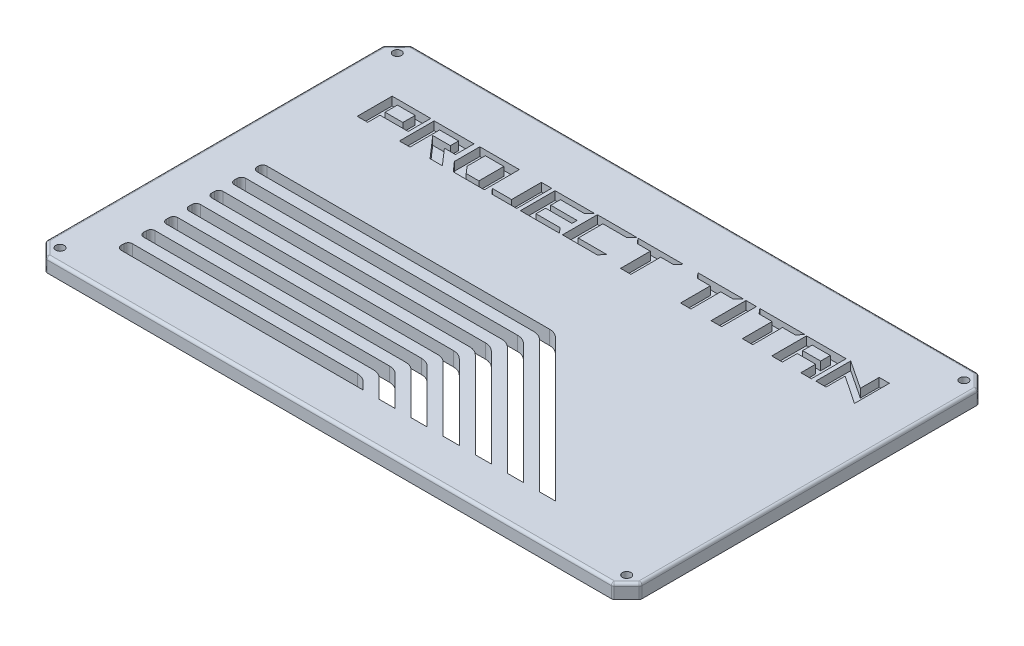
from build123d import *

# Parameters (mm, degrees)
SKETCH1_W           = 105
SKETCH1_H           = 69
BOSS_EXTRUDE1_DEPTH = 5
SKETCH2_W           = 86.836
SKETCH2_H           = 57.499
CUT_EXTRUDE1_DEPTH  = 81.210381
CUT_EXTRUDE2_DEPTH  = 1
SKETCH4_W           = 5
SKETCH4_H           = 2.165
SKETCH4_H_2         = 0.335
CUT_EXTRUDE3_DEPTH  = 1
CUT_EXTRUDE4_DEPTH  = 81.210381
SKETCH9_R           = 1
CUT_EXTRUDE7_DEPTH  = 4
SKETCH7_W           = 105
SKETCH7_H           = 30
BOSS_EXTRUDE2_DEPTH = 5
SKETCH8_W           = 11
SKETCH8_H           = 13.2
CUT_EXTRUDE6_DEPTH  = 84.315665
SKETCH10_W          = 105
SKETCH10_H          = 99
SKETCH10_W_2        = 11
SKETCH10_H_2        = 13.2
SKETCH10_H_3        = 30
BOSS_EXTRUDE3_DEPTH = 2
SKETCH11_W          = 77.336
SKETCH11_H          = 53.499
BOSS_EXTRUDE4_DEPTH = 2
CHAMFER1_SIZE       = 1
SKETCH12_W          = 65
SKETCH12_H          = 129
SKETCH12_R          = 6
BOSS_EXTRUDE5_DEPTH = 7
CUT_EXTRUDE8_DEPTH  = 135.221831
CUT_EXTRUDE9_START  = -3
SKETCH16_R          = 5.5
SKETCH16_R_2        = 3.1
CUT_EXTRUDE9_DEPTH  = 3
SKETCH18_R          = 10
CUT_EXTRUDE10_DEPTH = 3
CHAMFER2_SIZE       = 1
SKETCH19_W          = 17.7
SKETCH19_H          = 13.5
CUT_EXTRUDE11_DEPTH = 2
SKETCH20_W          = 17.7
SKETCH20_H          = 3.413443
SKETCH20_H_2        = 4.222497
CUT_EXTRUDE12_DEPTH = 1
SKETCH22_W          = 35.5
SKETCH22_H          = 10
SKETCH22_R          = 1
CUT_EXTRUDE13_DEPTH = 2
SKETCH23_R          = 1
CUT_EXTRUDE14_DEPTH = 4
CUT_EXTRUDE15_DEPTH = 1
SKETCH25_R          = 3.1
CUT_EXTRUDE16_DEPTH = 135.221831
SKETCH26_R          = 5.15
CUT_EXTRUDE17_DEPTH = 4
SKETCH27_W          = 40
SKETCH27_H          = 129
BOSS_EXTRUDE6_DEPTH = 7
LPATTERN1_COUNT     = 2
LPATTERN1_PITCH     = 40
SKETCH28_R          = 3.45
CUT_EXTRUDE18_DEPTH = 135.221831
SKETCH29_R          = 3.45
CUT_EXTRUDE19_DEPTH = 135.221831
SKETCH30_R          = 5
CUT_EXTRUDE20_DEPTH = 4.5
SKETCH31_R          = 5.5
CUT_EXTRUDE21_DEPTH = 2
CUT_EXTRUDE22_DEPTH = 2.5
LPATTERN2_COUNT     = 4
LPATTERN2_PITCH     = 32
SKETCH33_R          = 6
CUT_EXTRUDE23_DEPTH = 135.221831
SKETCH34_R          = 10
CUT_EXTRUDE24_DEPTH = 3
CHAMFER3_SIZE       = 1
CHAMFER4_SIZE       = 5
FILLET1_R           = 1
SKETCH36_R          = 1.5
CUT_EXTRUDE25_DEPTH = 135.221831
SKETCH38_W          = 2.122677
SKETCH38_H          = 1.133369
SKETCH38_W_2        = 1.231776
SKETCH38_H_2        = 4.10931
SKETCH38_W_3        = 2.093359
SKETCH38_H_3        = 1.448948
SKETCH38_W_4        = 2.046448
SKETCH38_H_4        = 0.961655
SKETCH38_H_5        = 1.340362
CUT_EXTRUDE27_DEPTH = 2
SKETCH40_R          = 6
CUT_EXTRUDE28_DEPTH = 135.221831
SKETCH41_R          = 1.5
BOSS_EXTRUDE7_DEPTH = 7
CUT_EXTRUDE29_START = -2
CUT_EXTRUDE29_DEPTH = 2
CUT_EXTRUDE30_DEPTH = 135.132397
FILLET2_R           = 1.5
SKETCH44_W          = 6.280076
SKETCH44_H          = 4.346843
SKETCH44_W_2        = 3.695328
SKETCH44_H_2        = 12.32793
SKETCH44_W_3        = 6.368032
SKETCH44_H_3        = 3.400107
CUT_EXTRUDE31_DEPTH = 3
FILLET3_R           = 5
FILLET4_R           = 1


with BuildPart() as part:
    # Sketch1 → Boss-Extrude1 (new body)
    with BuildSketch(Plane(origin=(0, 0, 0), x_dir=(1, 0, 0), z_dir=(0, 1, 0))):
        Rectangle(SKETCH1_W, SKETCH1_H)
    extrude(amount=BOSS_EXTRUDE1_DEPTH)

    # Sketch2 → Cut-Extrude1 (cut, through all)
    with BuildSketch(Plane(origin=(17.072113, 0, 5.103361), x_dir=(-1, 0, 0), z_dir=(0, -1, 0))):
        with Locations((16.310113, 4.341361)):
            Rectangle(SKETCH2_W, SKETCH2_H)
    extrude(amount=-CUT_EXTRUDE1_DEPTH, mode=Mode.SUBTRACT)

    # Sketch3 → Cut-Extrude2 (cut)
    with BuildSketch(Plane(origin=(17.072113, 0, 5.103361), x_dir=(-1, 0, 0), z_dir=(0, -1, 0))):
        Polygon((59.822113, 30.765861), (54.524774, 30.765861), (54.524774, -16.234139), (59.822113, -16.234139), (65.822113, -16.234139), (65.822113, 30.765861), align=None)
    extrude(amount=-CUT_EXTRUDE2_DEPTH, mode=Mode.SUBTRACT)

    # Sketch4 → Cut-Extrude3 (cut)
    with BuildSketch(Plane(origin=(17.072113, 0, 5.103361), x_dir=(-1, 0, 0), z_dir=(0, -1, 0))):
        Polygon((-1.187888, 35.255861), (3.812112, 35.255861), (3.812112, 33.090861), (4.312112, 33.090861), (4.312112, 35.755861), (-1.687888, 35.755861), (-1.687888, 33.090861), (-1.187888, 33.090861), align=None)
        with Locations((1.312112, 34.173361)):
            Rectangle(SKETCH4_W, SKETCH4_H)
        Polygon((4.312112, 33.090861), (3.812112, 33.090861), (3.812112, 32.755861), (-1.187888, 32.755861), (-1.187888, 33.090861), (-1.687888, 33.090861), (-1.687888, 32.255861), (4.312112, 32.255861), align=None)
        with Locations((1.312112, 32.923361)):
            Rectangle(SKETCH4_W, SKETCH4_H_2)
    extrude(amount=-CUT_EXTRUDE3_DEPTH, mode=Mode.SUBTRACT)

    # Sketch5 → Cut-Extrude4 (cut, through all)
    with BuildSketch(Plane(origin=(17.072113, 0, 5.103361), x_dir=(-1, 0, 0), z_dir=(0, -1, 0))):
        with BuildLine():
            Line((-31.677887, -0.896639), (-31.677887, 11.103361))
            ThreePointArc((-31.677887, 11.103361), (-31.2204, 12.207833), (-30.115928, 12.66532))
            Line((-30.115928, 12.66532), (-28.350144, 12.66532))
            ThreePointArc((-28.350144, 12.66532), (-27.521233, 13.008666), (-27.177887, 13.837577))
            Line((-27.177887, 13.837577), (-18.865935, 13.837577))
            Line((-18.865935, 13.837577), (-18.865935, -4.565971))
            Line((-18.865935, -4.565971), (-27.177887, -4.565971))
            ThreePointArc((-27.177887, -4.565971), (-27.608416, -3.526581), (-28.647806, -3.096052))
            Line((-28.647806, -3.096052), (-29.478474, -3.096052))
            ThreePointArc((-29.478474, -3.096052), (-31.033694, -2.451859), (-31.677887, -0.896639))
        make_face()
    extrude(amount=-CUT_EXTRUDE4_DEPTH, mode=Mode.SUBTRACT)

    # Sketch9 → Cut-Extrude7 (cut)
    with BuildSketch(Plane(origin=(17.072113, 0, 5.103361), x_dir=(-1, 0, 0), z_dir=(0, -1, 0))):
        with Locations(Location((-28.677887, 33.103361, 0), (0, 0, 90))):
            Circle(SKETCH9_R)
        with Locations(Location((62.822113, 33.103361, 0), (0, 0, 90))):
            Circle(SKETCH9_R)
        with Locations(Location((-28.677887, -22.896639, 0), (0, 0, 90))):
            Circle(SKETCH9_R)
        with Locations(Location((62.822113, -22.896639, 0), (0, 0, 90))):
            Circle(SKETCH9_R)
    extrude(amount=-CUT_EXTRUDE7_DEPTH, mode=Mode.SUBTRACT)

    # Sketch7 → Boss-Extrude2 (add)
    with BuildSketch(Plane(origin=(0, 5, 0), x_dir=(1, 0, 0), z_dir=(0, 1, 0))):
        with Locations((0, 49.5)):
            Rectangle(SKETCH7_W, SKETCH7_H)
        with Locations((0, -49.5)):
            Rectangle(SKETCH7_W, SKETCH7_H)
    extrude(amount=-BOSS_EXTRUDE2_DEPTH)

    # Sketch8 → Cut-Extrude6 (cut, through all)
    with BuildSketch(Plane(origin=(0, 5, 0), x_dir=(1, 0, 0), z_dir=(0, 1, 0))):
        with Locations((32.18, 46.886315)):
            Rectangle(SKETCH8_W, SKETCH8_H)
    extrude(amount=-CUT_EXTRUDE6_DEPTH, mode=Mode.SUBTRACT)

    # Sketch10 → Boss-Extrude3 (add)
    # profile 1 of 2: a face of its own
    with BuildSketch(Plane(origin=(0, 5, 0), x_dir=(1, 0, 0), z_dir=(0, 1, 0))):
        with Locations((0, 15)):
            Rectangle(SKETCH10_W, SKETCH10_H)
        Polygon((-42.656, 27.9875), (44.18, 27.9875), (44.18, 8.734216), (44.18, -9.669332), (44.18, -29.5115), (-42.656, -29.5115), align=None, mode=Mode.SUBTRACT)
        with Locations((32.18, 46.886315)):
            Rectangle(SKETCH10_W_2, SKETCH10_H_2, mode=Mode.SUBTRACT)
    # profile 2 of 2: a face of its own
    with BuildSketch(Plane(origin=(0, 5, 0), x_dir=(1, 0, 0), z_dir=(0, 1, 0))):
        with Locations((0, -49.5)):
            Rectangle(SKETCH10_W, SKETCH10_H_3)
    extrude(amount=BOSS_EXTRUDE3_DEPTH)

    # Sketch11 → Boss-Extrude4 (add)
    with BuildSketch(Plane(origin=(0, 7, 0), x_dir=(1, 0, 0), z_dir=(0, 1, 0))):
        Polygon((-40.656, 27.9875), (-42.656, 27.9875), (-42.656, 25.9875), (-42.656, -27.5115), (-42.656, -29.5115), (-40.656, -29.5115), (36.68, -29.5115), (44.18, -29.5115), (44.18, 27.9875), (36.68, 27.9875), align=None)
        with Locations((-1.988, -0.762)):
            Rectangle(SKETCH11_W, SKETCH11_H, mode=Mode.SUBTRACT)
    extrude(amount=-BOSS_EXTRUDE4_DEPTH)

    # Chamfer1
    chamfer1_edges = [part.edges().sort_by_distance(p)[0] for p in [
        (-40.656, 7, 0.762),
        (-1.988, 7, 27.5115),
        (36.68, 7, 0.762),
        (-1.988, 7, -25.9875),
    ]]
    chamfer(chamfer1_edges, length=CHAMFER1_SIZE)

    # Sketch12 → Boss-Extrude5 (add)
    with BuildSketch(Plane(origin=(0, 7, 0), x_dir=(1, 0, 0), z_dir=(0, 1, 0))):
        with Locations((-85, 0)):
            Rectangle(SKETCH12_W, SKETCH12_H)
        with Locations(Location((-85, -45.5, 0), (0, 0, 270))):
            Circle(SKETCH12_R, mode=Mode.SUBTRACT)
        with Locations(Location((-102.5, -28, 0), (0, 0, 270))):
            Circle(SKETCH12_R, mode=Mode.SUBTRACT)
        with Locations(Location((-67.5, -28, 0), (0, 0, 270))):
            Circle(SKETCH12_R, mode=Mode.SUBTRACT)
        with Locations(Location((-85, -10.5, 0), (0, 0, 270))):
            Circle(SKETCH12_R, mode=Mode.SUBTRACT)
    extrude(amount=-BOSS_EXTRUDE5_DEPTH)

    # Sketch15 → Cut-Extrude8 (cut, through all)
    with BuildSketch(Plane(origin=(0, 7, 0), x_dir=(1, 0, 0), z_dir=(0, 1, 0))):
        with BuildLine():
            ThreePointArc((-28.941, -46.50575), (-32.041, -43.40575), (-35.141, -46.50575))
            Line((-35.141, -46.50575), (-28.941, -46.50575))
        make_face()
        with BuildLine():
            Line((-28.941, -46.50575), (-35.141, -46.50575))
            ThreePointArc((-35.141, -46.50575), (-32.041, -49.60575), (-28.941, -46.50575))
        make_face()
        with BuildLine():
            ThreePointArc((-8.941, -46.50575), (-12.041, -43.40575), (-15.141, -46.50575))
            Line((-15.141, -46.50575), (-8.941, -46.50575))
        make_face()
        with BuildLine():
            Line((-8.941, -46.50575), (-15.141, -46.50575))
            ThreePointArc((-15.141, -46.50575), (-12.041, -49.60575), (-8.941, -46.50575))
        make_face()
        with BuildLine():
            ThreePointArc((4.859, -46.50575), (7.959, -49.60575), (11.059, -46.50575))
            Line((11.059, -46.50575), (4.859, -46.50575))
        make_face()
        with BuildLine():
            Line((4.859, -46.50575), (11.059, -46.50575))
            ThreePointArc((11.059, -46.50575), (7.959, -43.40575), (4.859, -46.50575))
        make_face()
        with BuildLine():
            ThreePointArc((24.859, -46.50575), (27.959, -49.60575), (31.059, -46.50575))
            Line((31.059, -46.50575), (24.859, -46.50575))
        make_face()
        with BuildLine():
            Line((24.859, -46.50575), (31.059, -46.50575))
            ThreePointArc((31.059, -46.50575), (27.959, -43.40575), (24.859, -46.50575))
        make_face()
    extrude(amount=-CUT_EXTRUDE8_DEPTH, mode=Mode.SUBTRACT)

    # Sketch16 → Cut-Extrude9 (cut)
    # profile 1 of 4: a face of its own
    with BuildSketch(Plane.XZ.offset(CUT_EXTRUDE9_START)):
        with Locations(Location((-32.041, 46.50575, 0), (0, 0, 270))):
            Circle(SKETCH16_R)
        with Locations(Location((-32.041, 46.50575, 0), (0, 0, 90))):
            Circle(SKETCH16_R_2, mode=Mode.SUBTRACT)
    # profile 2 of 4: a face of its own
    with BuildSketch(Plane.XZ.offset(CUT_EXTRUDE9_START)):
        with Locations(Location((-12.041, 46.50575, 0), (0, 0, 270))):
            Circle(SKETCH16_R)
        with Locations(Location((-12.041, 46.50575, 0), (0, 0, 90))):
            Circle(SKETCH16_R_2, mode=Mode.SUBTRACT)
    # profile 3 of 4: a face of its own
    with BuildSketch(Plane.XZ.offset(CUT_EXTRUDE9_START)):
        with Locations(Location((7.959, 46.50575, 0), (0, 0, 270))):
            Circle(SKETCH16_R)
        with Locations(Location((7.959, 46.50575, 0), (0, 0, 90))):
            Circle(SKETCH16_R_2, mode=Mode.SUBTRACT)
    # profile 4 of 4: a face of its own
    with BuildSketch(Plane.XZ.offset(CUT_EXTRUDE9_START)):
        with Locations(Location((27.959, 46.50575, 0), (0, 0, 270))):
            Circle(SKETCH16_R)
        with Locations(Location((27.959, 46.50575, 0), (0, 0, 90))):
            Circle(SKETCH16_R_2, mode=Mode.SUBTRACT)
    extrude(amount=CUT_EXTRUDE9_DEPTH, mode=Mode.SUBTRACT)

    # Sketch18 → Cut-Extrude10 (cut)
    with BuildSketch(Plane.XZ):
        with Locations(Location((-85, 45.5, 0), (0, 0, 270))):
            Circle(SKETCH18_R)
        with Locations(Location((-102.5, 28, 0), (0, 0, 270))):
            Circle(SKETCH18_R)
        with Locations(Location((-85, 10.5, 0), (0, 0, 270))):
            Circle(SKETCH18_R)
        with Locations(Location((-67.5, 28, 0), (0, 0, 270))):
            Circle(SKETCH18_R)
    extrude(amount=-CUT_EXTRUDE10_DEPTH, mode=Mode.SUBTRACT)

    # Chamfer2
    chamfer2_edges = [part.edges().sort_by_distance(p)[0] for p in [
        (-85, 0, 20.5),
        (-102.5, 0, 38),
        (-67.5, 0, 38),
        (-85, 0, 55.5),
    ]]
    chamfer(chamfer2_edges, length=CHAMFER2_SIZE)

    # Sketch19 → Cut-Extrude11 (cut)
    with BuildSketch(Plane.XZ):
        with Locations((9.346, -57.75)):
            Rectangle(SKETCH19_W, SKETCH19_H)
    extrude(amount=-CUT_EXTRUDE11_DEPTH, mode=Mode.SUBTRACT)

    # Sketch20 → Cut-Extrude12 (cut)
    with BuildSketch(Plane.XZ.offset(-2)):
        with Locations((9.346, -62.793278)):
            Rectangle(SKETCH20_W, SKETCH20_H)
        with Locations((9.346, -53.111249)):
            Rectangle(SKETCH20_W, SKETCH20_H_2)
    extrude(amount=-CUT_EXTRUDE12_DEPTH, mode=Mode.SUBTRACT)

    # Sketch22 → Cut-Extrude13 (cut)
    with BuildSketch(Plane.XZ):
        with Locations((-42.589089, -59.5)):
            Rectangle(SKETCH22_W, SKETCH22_H)
        with Locations(Location((-57.839089, -59.5, 0), (0, 0, 270))):
            Circle(SKETCH22_R, mode=Mode.SUBTRACT)
    extrude(amount=-CUT_EXTRUDE13_DEPTH, mode=Mode.SUBTRACT)

    # Sketch23 → Cut-Extrude14 (cut)
    with BuildSketch(Plane.XZ):
        with Locations(Location((-57.839089, -59.5, 0), (0, 0, 270))):
            Circle(SKETCH23_R)
    extrude(amount=-CUT_EXTRUDE14_DEPTH, mode=Mode.SUBTRACT)

    # Sketch24 → Cut-Extrude15 (cut)
    with BuildSketch(Plane.XZ.offset(-2)):
        with BuildLine():
            Line((-35.839089, -62.003634), (-25.839089, -62.003634))
            ThreePointArc((-25.839089, -62.003634), (-24.842723, -63), (-25.839089, -63.996366))
            Line((-25.839089, -63.996366), (-35.839089, -63.996366))
            ThreePointArc((-35.839089, -63.996366), (-36.835455, -63), (-35.839089, -62.003634))
        make_face()
    extrude(amount=-CUT_EXTRUDE15_DEPTH, mode=Mode.SUBTRACT)

    # Sketch25 → Cut-Extrude16 (cut, through all)
    with BuildSketch(Plane(origin=(0, 7, 0), x_dir=(1, 0, 0), z_dir=(0, 1, 0))):
        with Locations(Location((-102.5, 44.5, 0), (0, 0, 270))):
            Circle(SKETCH25_R)
        with Locations(Location((-82.5, 44.5, 0), (0, 0, 270))):
            Circle(SKETCH25_R)
    cut_extrude16 = extrude(amount=-CUT_EXTRUDE16_DEPTH, mode=Mode.SUBTRACT)

    # Sketch26 → Cut-Extrude17 (cut)
    with BuildSketch(Plane.XZ):
        with Locations(Location((-102.5, -44.5, 0), (0, 0, 270))):
            Circle(SKETCH26_R)
        with Locations(Location((-82.5, -44.5, 0), (0, 0, 270))):
            Circle(SKETCH26_R)
    cut_extrude17 = extrude(amount=-CUT_EXTRUDE17_DEPTH, mode=Mode.SUBTRACT)

    # Sketch27 → Boss-Extrude6 (add)
    with BuildSketch(Plane(origin=(0, 7, 0), x_dir=(1, 0, 0), z_dir=(0, 1, 0))):
        with Locations((72.5, 0)):
            Rectangle(SKETCH27_W, SKETCH27_H)
    extrude(amount=-BOSS_EXTRUDE6_DEPTH)

    # LPattern1: Cut-Extrude16, Cut-Extrude17 ×2
    with Locations(*[(i * LPATTERN1_PITCH, 0, 0) for i in range(1, LPATTERN1_COUNT)]):
        add(cut_extrude16, mode=Mode.SUBTRACT)
        add(cut_extrude17, mode=Mode.SUBTRACT)

    # Sketch28 → Cut-Extrude18 (cut, through all)
    with BuildSketch(Plane(origin=(0, 7, 0), x_dir=(1, 0, 0), z_dir=(0, 1, 0))):
        with Locations(Location((62.5, 48.27975, 0), (0, 0, 270))):
            Circle(SKETCH28_R)
        with Locations(Location((62.5, 16.27975, 0), (0, 0, 270))):
            Circle(SKETCH28_R)
        with Locations(Location((62.5, -15.72025, 0), (0, 0, 270))):
            Circle(SKETCH28_R)
        with Locations(Location((62.5, -47.72025, 0), (0, 0, 270))):
            Circle(SKETCH28_R)
    extrude(amount=-CUT_EXTRUDE18_DEPTH, mode=Mode.SUBTRACT)

    # Sketch29 → Cut-Extrude19 (cut, through all)
    with BuildSketch(Plane(origin=(0, 7, 0), x_dir=(1, 0, 0), z_dir=(0, 1, 0))):
        with Locations(Location((83.375, 48.27975, 0), (0, 0, 270))):
            Circle(SKETCH29_R)
        with Locations(Location((83.375, 16.27975, 0), (0, 0, 270))):
            Circle(SKETCH29_R)
        with Locations(Location((83.375, -15.72025, 0), (0, 0, 270))):
            Circle(SKETCH29_R)
        with Locations(Location((83.375, -47.72025, 0), (0, 0, 270))):
            Circle(SKETCH29_R)
    extrude(amount=-CUT_EXTRUDE19_DEPTH, mode=Mode.SUBTRACT)

    # Sketch30 → Cut-Extrude20 (cut)
    with BuildSketch(Plane.XZ):
        with Locations(Location((83.375, -48.27975, 0), (0, 0, 270))):
            Circle(SKETCH30_R)
        with Locations(Location((83.375, -16.27975, 0), (0, 0, 270))):
            Circle(SKETCH30_R)
        with Locations(Location((83.375, 15.72025, 0), (0, 0, 270))):
            Circle(SKETCH30_R)
        with Locations(Location((83.375, 47.72025, 0), (0, 0, 270))):
            Circle(SKETCH30_R)
    extrude(amount=-CUT_EXTRUDE20_DEPTH, mode=Mode.SUBTRACT)

    # Sketch31 → Cut-Extrude21 (cut)
    with BuildSketch(Plane.XZ):
        with Locations(Location((62.5, 47.72025, 0), (0, 0, 270))):
            Circle(SKETCH31_R)
        with Locations(Location((62.5, 15.72025, 0), (0, 0, 270))):
            Circle(SKETCH31_R)
        with Locations(Location((62.5, -16.27975, 0), (0, 0, 270))):
            Circle(SKETCH31_R)
        with Locations(Location((62.5, -48.27975, 0), (0, 0, 270))):
            Circle(SKETCH31_R)
    extrude(amount=-CUT_EXTRUDE21_DEPTH, mode=Mode.SUBTRACT)

    # Sketch32 → Cut-Extrude22 (cut)
    with BuildSketch(Plane.XZ):
        with BuildLine():
            Line((69.950503, 49.22025), (70.968176, 49.22025))
            ThreePointArc((70.968176, 49.22025), (71.1, 47.72025), (70.968176, 46.22025))
            Line((70.968176, 46.22025), (69.950503, 46.22025))
            ThreePointArc((69.950503, 46.22025), (70.1, 47.72025), (69.950503, 49.22025))
        make_face()
        with BuildLine():
            Line((61, 56.188426), (61, 55.170753))
            ThreePointArc((61, 55.170753), (62.5, 55.32025), (64, 55.170753))
            Line((64, 55.170753), (64, 56.188426))
            ThreePointArc((64, 56.188426), (62.5, 56.32025), (61, 56.188426))
        make_face()
        with BuildLine():
            Line((54.031824, 49.22025), (55.049497, 49.22025))
            ThreePointArc((55.049497, 49.22025), (54.9, 47.72025), (55.049497, 46.22025))
            Line((55.049497, 46.22025), (54.031824, 46.22025))
            ThreePointArc((54.031824, 46.22025), (53.9, 47.72025), (54.031824, 49.22025))
        make_face()
        with BuildLine():
            Line((64, 40.269747), (64, 39.252074))
            ThreePointArc((64, 39.252074), (62.5, 39.12025), (61, 39.252074))
            Line((61, 39.252074), (61, 40.269747))
            ThreePointArc((61, 40.269747), (62.5, 40.12025), (64, 40.269747))
        make_face()
    cut_extrude22 = extrude(amount=-CUT_EXTRUDE22_DEPTH, mode=Mode.SUBTRACT)

    # LPattern2: Cut-Extrude22 ×4
    with Locations(*[(0, 0, -i * LPATTERN2_PITCH) for i in range(1, LPATTERN2_COUNT)]):
        add(cut_extrude22, mode=Mode.SUBTRACT)

    # Sketch33 → Cut-Extrude23 (cut, through all)
    with BuildSketch(Plane(origin=(0, 7, 0), x_dir=(1, 0, 0), z_dir=(0, 1, 0))):
        with Locations(Location((-52.041, -46.50575, 0), (0, 0, 270))):
            Circle(SKETCH33_R)
    extrude(amount=-CUT_EXTRUDE23_DEPTH, mode=Mode.SUBTRACT)

    # Sketch34 → Cut-Extrude24 (cut)
    with BuildSketch(Plane.XZ):
        with Locations(Location((-52.041, 46.50575, 0), (0, 0, 270))):
            Circle(SKETCH34_R)
    extrude(amount=-CUT_EXTRUDE24_DEPTH, mode=Mode.SUBTRACT)

    # Chamfer3
    chamfer3_edges = [part.edges().sort_by_distance(p)[0] for p in [
        (-52.041, 0, 56.50575),
    ]]
    chamfer(chamfer3_edges, length=CHAMFER3_SIZE)

    # Chamfer4
    chamfer4_edges = [part.edges().sort_by_distance(p)[0] for p in [
        (-117.5, 3.5, -64.5),
        (-117.5, 3.5, 64.5),
        (92.5, 3.5, -64.5),
        (92.5, 3.5, 64.5),
    ]]
    chamfer(chamfer4_edges, length=CHAMFER4_SIZE)

    # Fillet1
    fillet1_edges = [part.edges().sort_by_distance(p)[0] for p in [
        (92.5, 7, 0),
        (92.5, 3.5, 59.5),
        (92.5, 3.5, -59.5),
        (-12.5, 7, -64.5),
        (-117.5, 7, 0),
        (-12.5, 7, 64.5),
        (-115, 7, -62),
        (-115, 7, 62),
        (90, 7, 62),
        (90, 7, -62),
        (-112.5, 3.5, -64.5),
        (87.5, 3.5, -64.5),
        (-112.5, 3.5, 64.5),
        (87.5, 3.5, 64.5),
        (-117.5, 3.5, -59.5),
        (-117.5, 3.5, 59.5),
    ]]
    fillet(fillet1_edges, radius=FILLET1_R)

    # Sketch36 → Cut-Extrude25 (cut, through all)
    with BuildSketch(Plane.XZ):
        with Locations(Location((87.525126, 59.525126, 0), (0, 0, 270))):
            Circle(SKETCH36_R)
        with Locations(Location((87.525126, -59.525126, 0), (0, 0, 270))):
            Circle(SKETCH36_R)
        with Locations(Location((-112.525126, -59.525126, 0), (0, 0, 270))):
            Circle(SKETCH36_R)
        with Locations(Location((-112.526828, 59.526828, 0), (0, 0, 270))):
            Circle(SKETCH36_R)
    extrude(amount=-CUT_EXTRUDE25_DEPTH, mode=Mode.SUBTRACT)

    # Sketch38 → Cut-Extrude27 (cut)
    # profile 1 of 26: a face of its own
    with BuildSketch(Plane.XZ):
        Polygon((-112.385598, -24.375998), (-109.048803, -26.612612), (-109.048803, -24.375998), (-107.831763, -24.375998), (-107.831763, -28.485308), (-111.185901, -26.26626), (-111.185901, -28.485308), (-112.385598, -28.485308), align=None)
    # profile 2 of 26: a face of its own
    with BuildSketch(Plane.XZ):
        Polygon((-107.333036, -28.442847), (-107.333036, -24.348284), (-106.101649, -24.348284), (-106.101649, -26.095682), (-103.932061, -26.095682), (-103.932061, -24.348284), (-102.677219, -24.348284), (-102.677219, -28.442847), align=None)
        with Locations((-105.010991, -27.272196)):
            Rectangle(SKETCH38_W, SKETCH38_H, mode=Mode.SUBTRACT)
    # profile 3 of 26: a face of its own
    with BuildSketch(Plane.XZ):
        Polygon((-101.928931, -27.880614), (-100.413224, -27.880614), (-100.413224, -24.375998), (-99.190124, -24.375998), (-99.190124, -27.880614), (-97.65686, -27.880614), (-97.136019, -28.485308), (-102.449957, -28.485308), align=None)
    # profile 4 of 26: a face of its own
    with BuildSketch(Plane.XZ):
        with Locations((-96.128202, -26.430653)):
            Rectangle(SKETCH38_W_2, SKETCH38_H_2)
    # profile 5 of 26: a face of its own
    with BuildSketch(Plane.XZ):
        Polygon((-94.653653, -27.880614), (-93.137946, -27.880614), (-93.137946, -24.375998), (-91.914846, -24.375998), (-91.914846, -27.880614), (-90.381582, -27.880614), (-89.860741, -28.485308), (-95.174678, -28.485308), align=None)
    # profile 6 of 26: a face of its own
    with BuildSketch(Plane.XZ):
        Polygon((-87.595547, -27.880614), (-86.07984, -27.880614), (-86.07984, -24.375998), (-84.85674, -24.375998), (-84.85674, -27.880614), (-83.323476, -27.880614), (-82.802635, -28.485308), (-88.116572, -28.485308), align=None)
    # profile 7 of 26: a face of its own
    with BuildSketch(Plane.XZ):
        Polygon((-82.632968, -24.980647), (-82.10675, -24.375998), (-78.024839, -24.375998), (-78.024839, -28.485308), (-82.627222, -28.485308), (-82.10675, -27.880614), (-79.276313, -27.880614), (-79.276313, -24.980647), align=None)
    # profile 8 of 26: a face of its own
    with BuildSketch(Plane.XZ):
        Polygon((-77.153032, -24.968132), (-77.680695, -24.364165), (-73.084165, -24.364165), (-73.084165, -28.442847), (-77.692294, -28.442847), (-77.170621, -27.838881), (-74.315378, -27.838881), (-74.315378, -26.705512), (-77.416864, -26.705512), (-77.416864, -26.101501), (-74.315378, -26.101501), (-74.315378, -24.968132), align=None)
    # profile 9 of 26: a face of its own
    with BuildSketch(Plane.XZ):
        Polygon((-69.702276, -24.375998), (-69.17506, -24.980647), (-71.430371, -24.980647), (-71.430371, -28.485308), (-72.643033, -28.485308), (-72.643033, -24.375998), align=None)
    # profile 10 of 26: a face of its own
    with BuildSketch(Plane.XZ):
        Polygon((-68.837425, -24.370908), (-68.837425, -28.490398), (-64.185183, -28.490398), (-64.185183, -25.496689), (-65.18709, -24.370908), align=None)
        Polygon((-67.605649, -27.89996), (-67.605649, -24.961346), (-66.109619, -24.961346), (-65.416959, -25.76436), (-65.416959, -27.89996), align=None, mode=Mode.SUBTRACT)
    # profile 11 of 26: a face of its own
    with BuildSketch(Plane.XZ):
        Polygon((-63.923182, -24.346978), (-62.474836, -24.346978), (-60.264202, -26.86839), (-62.33997, -26.86839), (-62.33997, -27.838881), (-60.108108, -27.838881), (-60.108108, -24.346978), (-58.864993, -24.346978), (-58.864993, -28.442847), (-63.547902, -28.442847), (-63.547902, -26.264424), (-62.24615, -26.264424), align=None)
    # profile 12 of 26: a face of its own
    with BuildSketch(Plane.XZ):
        Polygon((-55.100502, -25.83517), (-55.100502, -24.38096), (-53.869114, -24.38096), (-53.869114, -28.49205), (-58.41352, -28.49205), (-58.41352, -25.83517), align=None)
        with Locations((-56.135453, -27.16361)):
            Rectangle(SKETCH38_W_3, SKETCH38_H_3, mode=Mode.SUBTRACT)
    # profile 13 of 26: a face of its own
    with BuildSketch(Plane.XZ):
        Polygon((-109.067914, -16.288872), (-107.619567, -16.288872), (-105.408934, -18.810284), (-107.484701, -18.810284), (-107.484701, -19.780775), (-105.25284, -19.780775), (-105.25284, -16.288872), (-104.009725, -16.288872), (-104.009725, -20.384741), (-108.692634, -20.384741), (-108.692634, -18.206318), (-107.390881, -18.206318), align=None)
    # profile 14 of 26: a face of its own
    with BuildSketch(Plane.XZ):
        Polygon((-103.132292, -16.910026), (-103.659955, -16.30606), (-99.063424, -16.30606), (-99.063424, -20.384741), (-103.671553, -20.384741), (-103.14988, -19.780775), (-100.294638, -19.780775), (-100.294638, -18.647406), (-103.396123, -18.647406), (-103.396123, -18.043396), (-100.294638, -18.043396), (-100.294638, -16.910026), align=None)
    # profile 15 of 26: a face of its own
    with BuildSketch(Plane.XZ):
        Polygon((-98.318439, -19.822508), (-96.802731, -19.822508), (-96.802731, -16.317892), (-95.579632, -16.317892), (-95.579632, -19.822508), (-94.046368, -19.822508), (-93.525526, -20.427202), (-98.839464, -20.427202), align=None)
    # profile 16 of 26: a face of its own
    with BuildSketch(Plane.XZ):
        Polygon((-92.997713, -19.822508), (-91.482005, -19.822508), (-91.482005, -16.317892), (-90.258906, -16.317892), (-90.258906, -19.822508), (-88.725642, -19.822508), (-88.2048, -20.427202), (-93.518738, -20.427202), align=None)
    # profile 17 of 26: a face of its own
    with BuildSketch(Plane.XZ):
        Polygon((-87.550165, -16.910026), (-88.077828, -16.30606), (-83.481298, -16.30606), (-83.481298, -20.384741), (-88.089427, -20.384741), (-87.567754, -19.780775), (-84.712511, -19.780775), (-84.712511, -18.647406), (-87.813997, -18.647406), (-87.813997, -18.043396), (-84.712511, -18.043396), (-84.712511, -16.910026), align=None)
    # profile 18 of 26: a face of its own
    with BuildSketch(Plane.XZ):
        Polygon((-83.039143, -16.311149), (-78.541647, -16.311149), (-78.541647, -20.434617), (-82.681454, -20.434617), (-82.681454, -18.868995), (-83.039143, -18.868995), align=None)
        with Locations((-80.790395, -19.349822)):
            Rectangle(SKETCH38_W_4, SKETCH38_H_4, mode=Mode.SUBTRACT)
        with Locations((-80.790395, -17.585297)):
            Rectangle(SKETCH38_W_4, SKETCH38_H_5, mode=Mode.SUBTRACT)
    # profile 19 of 26: a face of its own
    with BuildSketch(Plane.XZ):
        Polygon((-76.058258, -19.822508), (-74.542551, -19.822508), (-74.542551, -16.317892), (-73.319451, -16.317892), (-73.319451, -19.822508), (-71.786188, -19.822508), (-71.265346, -20.427202), (-76.579284, -20.427202), align=None)
    # profile 20 of 26: a face of its own
    with BuildSketch(Plane.XZ):
        Polygon((-70.955251, -16.927373), (-70.424137, -16.30606), (-66.741362, -16.30606), (-66.216085, -16.910026), (-69.501984, -16.910026), (-69.717932, -17.158676), (-69.717932, -18.043396), (-66.373668, -18.043396), (-66.373668, -19.734322), (-66.928127, -20.384741), (-71.095678, -20.384741), (-70.58172, -19.780775), (-67.856116, -19.780775), (-67.593478, -19.484389), (-67.593478, -18.647406), (-70.955251, -18.647406), align=None)
    # profile 21 of 26: a face of its own
    with BuildSketch(Plane.XZ):
        Polygon((-65.774953, -20.427202), (-65.774953, -16.317892), (-61.166824, -16.317892), (-61.166824, -20.427202), (-62.386312, -20.427202), (-62.386312, -16.922541), (-64.573182, -16.922541), (-64.573182, -20.427202), align=None)
    # profile 22 of 26: a face of its own
    with BuildSketch(Plane.XZ):
        Polygon((-57.784935, -16.317892), (-57.25772, -16.922541), (-59.513031, -16.922541), (-59.513031, -20.427202), (-60.725693, -20.427202), (-60.725693, -16.317892), align=None)
    # profile 23 of 26: a face of its own
    with BuildSketch(Plane.XZ):
        Polygon((-91.614751, -8.254696), (-92.834411, -9.614447), (-91.614751, -10.962565), (-89.392389, -10.962565), (-89.392389, -11.783748), (-92.312537, -11.783748), (-92.834411, -12.374186), (-88.313459, -12.374186), (-88.313459, -10.372127), (-90.694142, -10.372127), (-91.374337, -9.614447), (-90.694142, -8.845134), (-88.647693, -8.845134), (-88.125819, -8.254696), align=None)
    # profile 24 of 26: a face of its own
    with BuildSketch(Plane.XZ):
        Polygon((-87.344538, -8.247954), (-83.459069, -8.247954), (-83.459069, -10.5893), (-86.488914, -10.5893), (-86.488914, -11.426283), (-86.225195, -11.722669), (-83.834137, -11.722669), (-83.318418, -12.326635), (-87.157004, -12.326635), (-87.713746, -11.676216), (-87.713746, -9.98529), (-84.701481, -9.98529), (-84.701481, -8.85192), (-87.872253, -8.85192), align=None)
    # profile 25 of 26: a face of its own
    with BuildSketch(Plane.XZ):
        Polygon((-82.931579, -11.724308), (-82.386977, -12.374186), (-78.873818, -12.374186), (-78.323451, -11.724308), (-78.323451, -8.904376), (-78.873818, -8.254696), (-82.386977, -8.254696), (-82.931579, -8.904376), align=None)
        Polygon((-81.743917, -11.439945), (-81.743917, -9.200588), (-81.447003, -8.845134), (-79.813968, -8.845134), (-79.511114, -9.200588), (-79.511114, -11.439945), (-79.813968, -11.783748), (-81.447003, -11.783748), align=None, mode=Mode.SUBTRACT)
    # profile 26 of 26: a face of its own
    with BuildSketch(Plane.XZ):
        Polygon((-77.46319, -8.247954), (-73.577721, -8.247954), (-73.577721, -10.5893), (-76.607566, -10.5893), (-76.607566, -11.426283), (-76.343846, -11.722669), (-73.952788, -11.722669), (-73.43707, -12.326635), (-77.275656, -12.326635), (-77.832397, -11.676216), (-77.832397, -9.98529), (-74.820133, -9.98529), (-74.820133, -8.85192), (-77.990905, -8.85192), align=None)
    extrude(amount=-CUT_EXTRUDE27_DEPTH, mode=Mode.SUBTRACT)

    # Sketch40 → Cut-Extrude28 (cut, through all)
    with BuildSketch(Plane(origin=(0, 7, 0), x_dir=(1, 0, 0), z_dir=(0, 1, 0))):
        with Locations(Location((-12.171545, 45.24375, 0), (0, 0, 270))):
            Circle(SKETCH40_R)
    extrude(amount=-CUT_EXTRUDE28_DEPTH, mode=Mode.SUBTRACT)

    # Sketch41 → Boss-Extrude7 (add)
    with BuildSketch(Plane.XZ):
        with BuildLine():
            Line((-60.339089, -64.5), (18.196, -64.5))
            Line((18.196, -64.5), (87.085786, -64.5))
            ThreePointArc((87.085786, -64.5), (87.46847, -64.42388), (87.792893, -64.207107))
            Line((87.792893, -64.207107), (92.207107, -59.792893))
            ThreePointArc((92.207107, -59.792893), (92.42388, -59.46847), (92.5, -59.085786))
            Line((92.5, -59.085786), (92.5, 59.085786))
            ThreePointArc((92.5, 59.085786), (92.42388, 59.46847), (92.207107, 59.792893))
            Line((92.207107, 59.792893), (87.792893, 64.207107))
            ThreePointArc((87.792893, 64.207107), (87.46847, 64.42388), (87.085786, 64.5))
            Line((87.085786, 64.5), (-112.085786, 64.5))
            ThreePointArc((-112.085786, 64.5), (-112.46847, 64.42388), (-112.792893, 64.207107))
            Line((-112.792893, 64.207107), (-117.207107, 59.792893))
            ThreePointArc((-117.207107, 59.792893), (-117.42388, 59.46847), (-117.5, 59.085786))
            Line((-117.5, 59.085786), (-117.5, -59.085786))
            ThreePointArc((-117.5, -59.085786), (-117.42388, -59.46847), (-117.207107, -59.792893))
            Line((-117.207107, -59.792893), (-112.792893, -64.207107))
            ThreePointArc((-112.792893, -64.207107), (-112.46847, -64.42388), (-112.085786, -64.5))
            Line((-112.085786, -64.5), (-60.339089, -64.5))
        make_face()
        with Locations(Location((-112.525126, -59.525126, 0), (0, 0, 270))):
            Circle(SKETCH41_R, mode=Mode.SUBTRACT)
        with Locations(Location((87.525126, -59.525126, 0), (0, 0, 270))):
            Circle(SKETCH41_R, mode=Mode.SUBTRACT)
        with Locations(Location((87.525126, 59.525126, 0), (0, 0, 270))):
            Circle(SKETCH41_R, mode=Mode.SUBTRACT)
        with Locations(Location((-112.526828, 59.526828, 0), (0, 0, 270))):
            Circle(SKETCH41_R, mode=Mode.SUBTRACT)
    extrude(amount=-BOSS_EXTRUDE7_DEPTH)

    # Sketch42 → Cut-Extrude29 (cut)
    with BuildSketch(Plane(origin=(0, 7, 0), x_dir=(1, 0, 0), z_dir=(0, 1, 0)).offset(CUT_EXTRUDE29_START)):
        with BuildLine():
            Line((92.5, -59.085786), (92.5, 59.085786))
            ThreePointArc((92.5, 59.085786), (92.42388, 59.46847), (92.207107, 59.792893))
            Line((92.207107, 59.792893), (87.792893, 64.207107))
            ThreePointArc((87.792893, 64.207107), (87.46847, 64.42388), (87.085786, 64.5))
            Line((87.085786, 64.5), (-112.085786, 64.5))
            ThreePointArc((-112.085786, 64.5), (-112.46847, 64.42388), (-112.792893, 64.207107))
            Line((-112.792893, 64.207107), (-117.207107, 59.792893))
            ThreePointArc((-117.207107, 59.792893), (-117.42388, 59.46847), (-117.5, 59.085786))
            Line((-117.5, 59.085786), (-117.5, -59.085786))
            ThreePointArc((-117.5, -59.085786), (-117.42388, -59.46847), (-117.207107, -59.792893))
            Line((-117.207107, -59.792893), (-112.792893, -64.207107))
            ThreePointArc((-112.792893, -64.207107), (-112.46847, -64.42388), (-112.085786, -64.5))
            Line((-112.085786, -64.5), (87.085786, -64.5))
            ThreePointArc((87.085786, -64.5), (87.46847, -64.42388), (87.792893, -64.207107))
            Line((87.792893, -64.207107), (92.207107, -59.792893))
            ThreePointArc((92.207107, -59.792893), (92.42388, -59.46847), (92.5, -59.085786))
        make_face()
    extrude(amount=CUT_EXTRUDE29_DEPTH, mode=Mode.SUBTRACT)

    # Sketch43 → Cut-Extrude30 (cut, through all)
    with BuildSketch(Plane(origin=(0, 5, 0), x_dir=(1, 0, 0), z_dir=(0, 1, 0))):
        Polygon((-19.553824, -45.5), (-102.5, -45.5), (-102.5, -49.5), (-15.553824, -49.5), align=None)
        Polygon((-16.240115, -37.5), (-102.5, -37.5), (-102.5, -41.5), (-17.89697, -41.5), (-9.89697, -49.5), (-4.240115, -49.5), align=None)
        Polygon((-12.926407, -29.5), (-102.5, -29.5), (-102.5, -33.5), (-14.583261, -33.5), (1.416739, -49.5), (7.073593, -49.5), align=None)
        Polygon((-9.612698, -21.5), (-102.5, -21.5), (-102.5, -25.5), (-11.269553, -25.5), (12.730447, -49.5), (18.387302, -49.5), align=None)
        Polygon((-6.29899, -13.5), (-102.5, -13.5), (-102.5, -17.5), (-7.955844, -17.5), (24.044156, -49.5), (29.70101, -49.5), align=None)
        Polygon((-2.985281, -5.5), (-102.5, -5.5), (-102.5, -9.5), (-4.642136, -9.5), (35.357864, -49.5), (41.014719, -49.5), align=None)
        Polygon((0.828427, 2), (-102.5, 2), (-102.5, -1.5), (-1.328427, -1.5), (46.671573, -49.5), (52.328427, -49.5), align=None)
    extrude(amount=-CUT_EXTRUDE30_DEPTH, mode=Mode.SUBTRACT)

    # Fillet2
    fillet2_edges = [part.edges().sort_by_distance(p)[0] for p in [
        (-102.5, 2.5, 25.5),
        (-102.5, 2.5, 21.5),
        (-102.5, 2.5, 17.5),
        (-102.5, 2.5, 13.5),
        (-102.5, 2.5, 41.5),
        (-102.5, 2.5, 37.5),
        (-102.5, 2.5, 33.5),
        (-102.5, 2.5, 29.5),
        (-102.5, 2.5, 1.5),
        (-102.5, 2.5, -2),
        (-102.5, 2.5, 9.5),
        (-102.5, 2.5, 5.5),
        (-102.5, 2.5, 49.5),
        (-102.5, 2.5, 45.5),
    ]]
    fillet(fillet2_edges, radius=FILLET2_R)

    # Sketch44 → Cut-Extrude31 (cut)
    # profile 1 of 12: a face of its own
    with BuildSketch(Plane(origin=(0, 5, 0), x_dir=(1, 0, 0), z_dir=(0, 1, 0))):
        Polygon((-96.573495, 37.491956), (-96.573495, 33.129326), (-100.267658, 33.129326), (-100.267658, 45.462597), (-86.634439, 45.462597), (-86.634439, 37.491956), align=None)
        with Locations((-93.46864, 41.477277)):
            Rectangle(SKETCH44_W, SKETCH44_H, mode=Mode.SUBTRACT)
    # profile 2 of 12: a face of its own
    with BuildSketch(Plane(origin=(0, 5, 0), x_dir=(1, 0, 0), z_dir=(0, 1, 0))):
        Polygon((-70.105454, 33.02738), (-74.450493, 33.02738), (-81.082394, 40.591617), (-74.855091, 40.591617), (-74.855091, 43.503089), (-81.550675, 43.503089), (-81.550675, 33.02738), (-85.28002, 33.02738), (-85.28002, 45.314987), (-71.231294, 45.314987), (-71.231294, 38.779719), (-75.136551, 38.779719), align=None)
    # profile 3 of 12: a face of its own
    with BuildSketch(Plane(origin=(0, 5, 0), x_dir=(1, 0, 0), z_dir=(0, 1, 0))):
        Polygon((-55.362726, 33.099171), (-55.362726, 45.457641), (-69.319452, 45.457641), (-69.319452, 36.476513), (-66.313729, 33.099171), align=None)
        Polygon((-59.058054, 43.686325), (-59.058054, 34.870485), (-63.546144, 34.870485), (-65.624124, 37.279527), (-65.624124, 43.686325), align=None, mode=Mode.SUBTRACT)
    # profile 4 of 12: a face of its own
    with BuildSketch(Plane(origin=(0, 5, 0), x_dir=(1, 0, 0), z_dir=(0, 1, 0))):
        Polygon((-52.768173, 33.114441), (-54.34982, 34.928388), (-47.583887, 34.928388), (-47.583887, 45.442371), (-43.9459, 45.442371), (-43.9459, 33.114441), align=None)
    # profile 5 of 12: a face of its own
    with BuildSketch(Plane(origin=(0, 5, 0), x_dir=(1, 0, 0), z_dir=(0, 1, 0))):
        Polygon((-30.415903, 34.890842), (-28.832914, 33.078943), (-42.622506, 33.078943), (-42.622506, 45.314987), (-28.798119, 45.314987), (-30.363137, 43.503089), (-38.928865, 43.503089), (-38.928865, 40.102982), (-29.624408, 40.102982), (-29.624408, 38.290951), (-38.928865, 38.290951), (-38.928865, 34.890842), align=None)
    # profile 6 of 12: a face of its own
    with BuildSketch(Plane(origin=(0, 5, 0), x_dir=(1, 0, 0), z_dir=(0, 1, 0))):
        Polygon((-13.976097, 34.928388), (-15.554751, 33.114441), (-27.800483, 33.114441), (-27.800483, 45.442371), (-13.993333, 45.442371), (-15.554751, 43.628288), (-24.046061, 43.628288), (-24.046061, 34.928388), align=None)
    # profile 7 of 12: a face of its own
    with BuildSketch(Plane(origin=(0, 5, 0), x_dir=(1, 0, 0), z_dir=(0, 1, 0))):
        Polygon((0.911641, 43.628288), (-3.635481, 43.628288), (-3.635481, 33.114441), (-7.30478, 33.114441), (-7.30478, 43.628288), (-11.904572, 43.628288), (-13.467096, 45.442371), (2.474717, 45.442371), align=None)
    # profile 8 of 12: a face of its own
    with BuildSketch(Plane(origin=(0, 5, 0), x_dir=(1, 0, 0), z_dir=(0, 1, 0))):
        Polygon((22.085959, 43.628288), (17.538837, 43.628288), (17.538837, 33.114441), (13.869537, 33.114441), (13.869537, 43.628288), (9.269746, 43.628288), (7.707222, 45.442371), (23.649035, 45.442371), align=None)
    # profile 9 of 12: a face of its own
    with BuildSketch(Plane(origin=(0, 5, 0), x_dir=(1, 0, 0), z_dir=(0, 1, 0))):
        with Locations((26.509607, 39.278406)):
            Rectangle(SKETCH44_W_2, SKETCH44_H_2)
    # profile 10 of 12: a face of its own
    with BuildSketch(Plane(origin=(0, 5, 0), x_dir=(1, 0, 0), z_dir=(0, 1, 0))):
        Polygon((43.911794, 43.628288), (39.364672, 43.628288), (39.364672, 33.114441), (35.695373, 33.114441), (35.695373, 43.628288), (31.095581, 43.628288), (29.533057, 45.442371), (45.47487, 45.442371), align=None)
    # profile 11 of 12: a face of its own
    with BuildSketch(Plane(origin=(0, 5, 0), x_dir=(1, 0, 0), z_dir=(0, 1, 0))):
        Polygon((60.124109, 45.314987), (60.124109, 33.031299), (56.429947, 33.031299), (56.429947, 38.273492), (49.921184, 38.273492), (49.921184, 33.031299), (46.156657, 33.031299), (46.156657, 45.314987), align=None)
        with Locations((53.157974, 41.803035)):
            Rectangle(SKETCH44_W_3, SKETCH44_H_3, mode=Mode.SUBTRACT)
    # profile 12 of 12: a face of its own
    with BuildSketch(Plane(origin=(0, 5, 0), x_dir=(1, 0, 0), z_dir=(0, 1, 0))):
        Polygon((75.281794, 33.114441), (65.271409, 39.824283), (65.271409, 33.114441), (61.62029, 33.114441), (61.62029, 45.442371), (71.682704, 38.785226), (71.682704, 45.442371), (75.281794, 45.442371), align=None)
    extrude(amount=-CUT_EXTRUDE31_DEPTH, mode=Mode.SUBTRACT)

    # Fillet3
    fillet3_edges = [part.edges().sort_by_distance(p)[0] for p in [
        (-11.269553, 2.5, 25.5),
        (-9.612698, 2.5, 21.5),
        (-7.955844, 2.5, 17.5),
        (-6.29899, 2.5, 13.5),
        (-17.89697, 2.5, 41.5),
        (-16.240115, 2.5, 37.5),
        (-14.583261, 2.5, 33.5),
        (-12.926407, 2.5, 29.5),
        (0.828427, 2.5, -2),
        (-1.328427, 2.5, 1.5),
        (-4.642136, 2.5, 9.5),
        (-2.985281, 2.5, 5.5),
        (-19.553824, 2.5, 45.5),
    ]]
    fillet(fillet3_edges, radius=FILLET3_R)

    # Fillet4
    fillet4_edges = [part.edges().sort_by_distance(p)[0] for p in [
        (92.42388, 5, 59.46847),
        (90, 5, 62),
        (87.46847, 5, 64.42388),
        (-12.5, 5, 64.5),
        (-112.46847, 5, 64.42388),
        (-115, 5, 62),
        (-117.42388, 5, 59.46847),
        (-117.5, 5, 0),
        (-117.42388, 5, -59.46847),
        (-115, 5, -62),
        (-112.46847, 5, -64.42388),
        (-12.5, 5, -64.5),
        (87.46847, 5, -64.42388),
        (90, 5, -62),
        (92.42388, 5, -59.46847),
        (92.5, 5, 0),
    ]]
    fillet(fillet4_edges, radius=FILLET4_R)


solid = part.part
